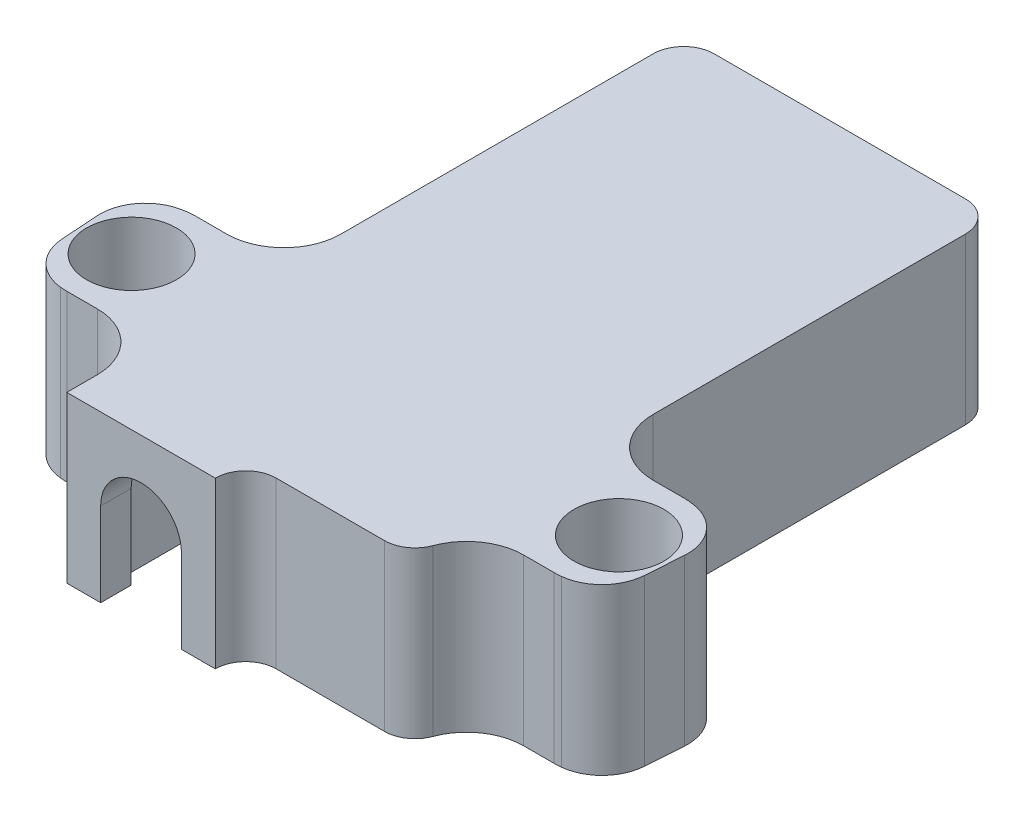
from build123d import *

# Parameters (mm, degrees)
SKETCH1_W           = 20.5
SKETCH1_H           = 38.5
SKETCH1_R           = 4.25
SKETCH1_R_2         = 1.75
BOSS_EXTRUDE1_DEPTH = 1.5
SKETCH2_W           = 20.5
SKETCH2_H           = 38.5
BOSS_EXTRUDE2_DEPTH = 7.35
SKETCH3_W           = 17.5
SKETCH3_H           = 35.5
SKETCH3_W_2         = 6.75
SKETCH3_H_2         = 1.5
CUT_EXTRUDE1_DEPTH  = 7.35
SKETCH4_W           = 7.2
SKETCH4_H           = 1.5
CUT_EXTRUDE2_DEPTH  = 4.05
SKETCH6_W           = 17.5
SKETCH6_H           = 1.5
BOSS_EXTRUDE3_DEPTH = 1.35
SKETCH7_W           = 3.5
SKETCH7_H           = 2
BOSS_EXTRUDE4_DEPTH = 1
SKETCH8_R           = 2.95
BOSS_EXTRUDE5_DEPTH = 7.35
FILLET2_R           = 3.75
CUT_EXTRUDE4_START  = -8.85
CUT_EXTRUDE4_DEPTH  = 8.85
FILLET5_R           = 3
SKETCH10_W          = 9.75
SKETCH10_H          = 2
BOSS_EXTRUDE6_DEPTH = 8.85
CUT_EXTRUDE5_REACH  = 47.729
FILLET4_R           = 2
BOSS_EXTRUDE7_START = 2
SKETCH12_R          = 1.75
BOSS_EXTRUDE7_DEPTH = 2


with BuildPart() as part:
    # Sketch1 → Boss-Extrude1 (new body)
    # profile 1 of 5: a face of its own
    with BuildSketch(Plane(origin=(0, 0, 0), x_dir=(1, 0, 0), z_dir=(0, 1, 0))):
        with Locations((0, 11.25)):
            Rectangle(SKETCH1_W, SKETCH1_H)
    # profile 2 of 5: a face of its own
    with BuildSketch(Plane(origin=(0, 0, 0), x_dir=(1, 0, 0), z_dir=(0, 1, 0))):
        with BuildLine():
            Line((-10.25, -4.25), (-10.25, 4.25))
            Line((-10.25, 4.25), (-16, 4.25))
            ThreePointArc((-16, 4.25), (-12.99479618, 3.00520382), (-11.75, 0))
            ThreePointArc((-11.75, 0), (-12.99479618, -3.00520382), (-16, -4.25))
            Line((-16, -4.25), (-10.25, -4.25))
        make_face()
    # profile 3 of 5: a face of its own
    with BuildSketch(Plane(origin=(0, 0, 0), x_dir=(1, 0, 0), z_dir=(0, 1, 0))):
        with Locations((-16, 0)):
            Circle(SKETCH1_R)
        with Locations(Location((-16, 0, 0), (0, 0, 270))):
            Circle(SKETCH1_R_2, mode=Mode.SUBTRACT)
    # profile 4 of 5: a face of its own
    with BuildSketch(Plane(origin=(0, 0, 0), x_dir=(1, 0, 0), z_dir=(0, 1, 0))):
        with BuildLine():
            Line((16, 4.25), (10.25, 4.25))
            Line((10.25, 4.25), (10.25, -4.25))
            Line((10.25, -4.25), (16, -4.25))
            ThreePointArc((16, -4.25), (11.75, 0), (16, 4.25))
        make_face()
    # profile 5 of 5: a face of its own
    with BuildSketch(Plane(origin=(0, 0, 0), x_dir=(1, 0, 0), z_dir=(0, 1, 0))):
        with Locations((16, 0)):
            Circle(SKETCH1_R)
        with Locations(Location((16, 0, 0), (0, 0, 270))):
            Circle(SKETCH1_R_2, mode=Mode.SUBTRACT)
    extrude(amount=BOSS_EXTRUDE1_DEPTH)

    # Sketch2 → Boss-Extrude2 (add)
    with BuildSketch(Plane(origin=(0, 1.5, 0), x_dir=(1, 0, 0), z_dir=(0, 1, 0))):
        with Locations((0, 11.25)):
            Rectangle(SKETCH2_W, SKETCH2_H)
    extrude(amount=BOSS_EXTRUDE2_DEPTH)

    # Sketch3 → Cut-Extrude1 (cut)
    with BuildSketch(Plane.XZ):
        with Locations((0, -11.25)):
            Rectangle(SKETCH3_W, SKETCH3_H)
        with Locations((-5.375, 7.25)):
            Rectangle(SKETCH3_W_2, SKETCH3_H_2)
    extrude(amount=-CUT_EXTRUDE1_DEPTH, mode=Mode.SUBTRACT)

    # Sketch4 → Cut-Extrude2 (cut)
    with BuildSketch(Plane.XZ):
        with Locations((-2.85, -29.75)):
            Rectangle(SKETCH4_W, SKETCH4_H)
    extrude(amount=-CUT_EXTRUDE2_DEPTH, mode=Mode.SUBTRACT)

    # Sketch6 → Boss-Extrude3 (add)
    with BuildSketch(Plane.XZ.offset(-7.35)):
        with Locations((0, -28.25)):
            Rectangle(SKETCH6_W, SKETCH6_H)
    extrude(amount=BOSS_EXTRUDE3_DEPTH)

    # Sketch7 → Boss-Extrude4 (add)
    with BuildSketch(Plane.XY.offset(-29)):
        with Locations((7, 3.25)):
            Rectangle(SKETCH7_W, SKETCH7_H)
    extrude(amount=BOSS_EXTRUDE4_DEPTH)

    # Sketch8 → Boss-Extrude5 (add)
    # profile 1 of 2: a face of its own
    with BuildSketch(Plane(origin=(0, 1.5, 0), x_dir=(1, 0, 0), z_dir=(0, 1, 0))):
        with BuildLine():
            Line((-10.25, -4.25), (-10.25, 4.25))
            Line((-10.25, 4.25), (-16, 4.25))
            ThreePointArc((-16, 4.25), (-20.25, 0), (-16, -4.25))
            Line((-16, -4.25), (-10.25, -4.25))
        make_face()
        with Locations(Location((-16, 0, 0), (0, 0, 90))):
            Circle(SKETCH8_R, mode=Mode.SUBTRACT)
    # profile 2 of 2: a face of its own
    with BuildSketch(Plane(origin=(0, 1.5, 0), x_dir=(1, 0, 0), z_dir=(0, 1, 0))):
        with BuildLine():
            Line((10.25, 4.25), (10.25, -4.25))
            Line((10.25, -4.25), (16, -4.25))
            ThreePointArc((16, -4.25), (20.25, 0), (16, 4.25))
            Line((16, 4.25), (10.25, 4.25))
        make_face()
        with Locations(Location((16, 0, 0), (0, 0, 90))):
            Circle(SKETCH8_R, mode=Mode.SUBTRACT)
    extrude(amount=BOSS_EXTRUDE5_DEPTH)

    # Fillet2
    fillet2_edges = [part.edges().sort_by_distance(p)[0] for p in [
        (10.25, 4.425, -4.25),
        (10.25, 4.425, 4.25),
        (-10.25, 4.425, 4.25),
        (-10.25, 4.425, -4.25),
    ]]
    fillet(fillet2_edges, radius=FILLET2_R - 0.0001)  # a hair under: the kernel refuses the full size

    # Sketch9 → Cut-Extrude4 (cut)
    with BuildSketch(Plane(origin=(0, 8.85, 0), x_dir=(1, 0, 0), z_dir=(0, 1, 0)).offset(CUT_EXTRUDE4_START)):
        with BuildLine():
            Line((-24.982948352, 53.686308531), (-20.952771504, -3.947905519))
            ThreePointArc((-20.952771504, -3.947905519), (-19.171836931, -8.143524448), (-15.185360396, -10.353264474))
            Line((-15.185360396, -10.353264474), (-1.215537244, -12.816521212))
            ThreePointArc((-1.215537244, -12.816521212), (0, -12.922866941), (1.215537244, -12.816521212))
            Line((1.215537244, -12.816521212), (15.185360396, -10.353264474))
            ThreePointArc((15.185360396, -10.353264474), (19.171836931, -8.143524448), (20.952771504, -3.947905519))
            Line((20.952771504, -3.947905519), (24.982948352, 53.686308531))
            ThreePointArc((24.982948352, 53.686308531), (24.995735789, 53.930307371), (25, 54.174603847))
            Line((25, 54.174603847), (25, 107.825396153))
            ThreePointArc((25, 107.825396153), (24.995735789, 108.069692629), (24.982948352, 108.313691469))
            Line((24.982948352, 108.313691469), (20.952771504, 165.947905519))
            ThreePointArc((20.952771504, 165.947905519), (19.171836931, 170.143524448), (15.185360396, 172.353264474))
            Line((15.185360396, 172.353264474), (1.215537244, 174.816521212))
            ThreePointArc((1.215537244, 174.816521212), (0, 174.922866941), (-1.215537244, 174.816521212))
            Line((-1.215537244, 174.816521212), (-15.185360396, 172.353264474))
            ThreePointArc((-15.185360396, 172.353264474), (-19.171836931, 170.143524448), (-20.952771504, 165.947905519))
            Line((-20.952771504, 165.947905519), (-24.982948352, 108.313691469))
            ThreePointArc((-24.982948352, 108.313691469), (-24.995735789, 108.069692629), (-25, 107.825396153))
            Line((-25, 107.825396153), (-25, 54.174603847))
            ThreePointArc((-25, 54.174603847), (-24.995735789, 53.930307371), (-24.982948352, 53.686308531))
        make_face()
        with BuildLine():
            Line((-18.957643404, 165.808392572), (-22.987820251, 108.174178521))
            ThreePointArc((-22.987820251, 108.174178521), (-22.996954135, 107.999893636), (-23, 107.825396153))
            Line((-23, 107.825396153), (-23, 54.174603847))
            ThreePointArc((-23, 54.174603847), (-22.996954135, 54.000106364), (-22.987820251, 53.825821479))
            Line((-22.987820251, 53.825821479), (-18.957643404, -3.808392572))
            ThreePointArc((-18.957643404, -3.808392572), (-17.68554728, -6.805263235), (-14.838064041, -8.383648968))
            Line((-14.838064041, -8.383648968), (-0.868240888, -10.846905706))
            ThreePointArc((-0.868240888, -10.846905706), (0, -10.922866941), (0.868240888, -10.846905706))
            Line((0.868240888, -10.846905706), (14.838064041, -8.383648968))
            ThreePointArc((14.838064041, -8.383648968), (17.68554728, -6.805263235), (18.957643404, -3.808392572))
            Line((18.957643404, -3.808392572), (22.987820251, 53.825821479))
            ThreePointArc((22.987820251, 53.825821479), (22.996954135, 54.000106364), (23, 54.174603847))
            Line((23, 54.174603847), (23, 107.825396153))
            ThreePointArc((23, 107.825396153), (22.996954135, 107.999893636), (22.987820251, 108.174178521))
            Line((22.987820251, 108.174178521), (18.957643404, 165.808392572))
            ThreePointArc((18.957643404, 165.808392572), (17.68554728, 168.805263235), (14.838064041, 170.383648968))
            Line((14.838064041, 170.383648968), (0.868240888, 172.846905706))
            ThreePointArc((0.868240888, 172.846905706), (0, 172.922866941), (-0.868240888, 172.846905706))
            Line((-0.868240888, 172.846905706), (-14.838064041, 170.383648968))
            ThreePointArc((-14.838064041, 170.383648968), (-17.68554728, 168.805263235), (-18.957643404, 165.808392572))
        make_face(mode=Mode.SUBTRACT)
    extrude(amount=CUT_EXTRUDE4_DEPTH, mode=Mode.SUBTRACT)

    # Fillet5
    fillet5_edges = [part.edges().sort_by_distance(p)[0] for p in [
        (-19.402072162, 4.425, -2.547234776),
        (-19.014456867, 4.425, 2.995922195),
        (19.014456867, 4.425, 2.995922195),
        (19.402072162, 4.425, -2.547234776),
    ]]
    fillet(fillet5_edges, radius=FILLET5_R)

    # Sketch10 → Boss-Extrude6 (add)
    with BuildSketch(Plane(origin=(0, 0, 0), x_dir=(1, 0, 0), z_dir=(0, 1, 0))):
        with Locations((-5.375, -9)):
            Rectangle(SKETCH10_W, SKETCH10_H)
    extrude(amount=BOSS_EXTRUDE6_DEPTH)

    # Sketch11 → Cut-Extrude5 (cut, up to next)
    with BuildSketch(Plane.XY.offset(10), mode=Mode.PRIVATE) as cut_extrude5_sk1:
        with BuildLine():
            ThreePointArc((-2.725, 3.5), (-3.50116703, 5.37383297), (-5.375, 6.15))
            Line((-5.375, 6.15), (-5.375, 0.85))
            ThreePointArc((-5.375, 0.85), (-3.50116703, 1.62616703), (-2.725, 3.5))
        make_face()
    cut_extrude5_tool1 = extrude(cut_extrude5_sk1.sketch, amount=-CUT_EXTRUDE5_REACH, mode=Mode.PRIVATE) & part.part
    # Sketch11 → Cut-Extrude5 (cut, up to next)
    with BuildSketch(Plane.XY.offset(10), mode=Mode.PRIVATE) as cut_extrude5_sk2:
        with BuildLine():
            Line((-5.375, 0.85), (-5.375, 6.15))
            ThreePointArc((-5.375, 6.15), (-7.24883297, 5.37383297), (-8.025, 3.5))
            ThreePointArc((-8.025, 3.5), (-7.24883297, 1.62616703), (-5.375, 0.85))
        make_face()
    cut_extrude5_tool2 = extrude(cut_extrude5_sk2.sketch, amount=-CUT_EXTRUDE5_REACH, mode=Mode.PRIVATE) & part.part
    # Sketch11 → Cut-Extrude5 (cut, up to next)
    with BuildSketch(Plane.XY.offset(10), mode=Mode.PRIVATE) as cut_extrude5_sk3:
        with BuildLine():
            ThreePointArc((-2.725, 3.5), (-3.50116703, 5.37383297), (-5.375, 6.15))
            Line((-5.375, 6.15), (-5.375, 0.85))
            ThreePointArc((-5.375, 0.85), (-3.50116703, 1.62616703), (-2.725, 3.5))
        make_face()
    cut_extrude5_tool3 = extrude(cut_extrude5_sk3.sketch, amount=-CUT_EXTRUDE5_REACH, mode=Mode.PRIVATE) & part.part
    # Sketch11 → Cut-Extrude5 (cut, up to next)
    with BuildSketch(Plane.XY.offset(10), mode=Mode.PRIVATE) as cut_extrude5_sk4:
        with BuildLine():
            Line((-5.375, 0.85), (-5.375, 6.15))
            ThreePointArc((-5.375, 6.15), (-7.24883297, 5.37383297), (-8.025, 3.5))
            ThreePointArc((-8.025, 3.5), (-7.24883297, 1.62616703), (-5.375, 0.85))
        make_face()
    cut_extrude5_tool4 = extrude(cut_extrude5_sk4.sketch, amount=-CUT_EXTRUDE5_REACH, mode=Mode.PRIVATE) & part.part
    # Sketch11 → Cut-Extrude5 (cut, up to next)
    with BuildSketch(Plane.XY.offset(10), mode=Mode.PRIVATE) as cut_extrude5_sk5:
        with BuildLine():
            Line((-5.375, 0), (-5.375, 0.85))
            ThreePointArc((-5.375, 0.85), (-7.24883297, 1.62616703), (-8.025, 3.5))
            Line((-8.025, 3.5), (-8.025, 0))
            Line((-8.025, 0), (-5.375, 0))
        make_face()
    cut_extrude5_tool5 = extrude(cut_extrude5_sk5.sketch, amount=-CUT_EXTRUDE5_REACH, mode=Mode.PRIVATE) & part.part
    # Sketch11 → Cut-Extrude5 (cut, up to next)
    with BuildSketch(Plane.XY.offset(10), mode=Mode.PRIVATE) as cut_extrude5_sk6:
        with BuildLine():
            ThreePointArc((-2.725, 3.5), (-3.50116703, 1.62616703), (-5.375, 0.85))
            Line((-5.375, 0.85), (-5.375, 0))
            Line((-5.375, 0), (-2.725, 0))
            Line((-2.725, 0), (-2.725, 3.5))
        make_face()
    cut_extrude5_tool6 = extrude(cut_extrude5_sk6.sketch, amount=-CUT_EXTRUDE5_REACH, mode=Mode.PRIVATE) & part.part
    add(cut_extrude5_tool1.solids().sort_by_distance((-4.250305, 3.5, 10))[0], mode=Mode.SUBTRACT)
    add(cut_extrude5_tool2.solids().sort_by_distance((-6.499695, 3.5, 10))[0], mode=Mode.SUBTRACT)
    add(cut_extrude5_tool3.solids().sort_by_distance((-4.250305, 3.5, 10))[0], mode=Mode.SUBTRACT)
    add(cut_extrude5_tool4.solids().sort_by_distance((-6.499695, 3.5, 10))[0], mode=Mode.SUBTRACT)
    add(cut_extrude5_tool5.solids().sort_by_distance((-6.993859, 0.832642, 10))[0], mode=Mode.SUBTRACT)
    add(cut_extrude5_tool6.solids().sort_by_distance((-3.756141, 0.832642, 10))[0], mode=Mode.SUBTRACT)

    # Fillet4
    fillet4_edges = [part.edges().sort_by_distance(p)[0] for p in [
        (10.25, 4.425, 8),
        (10.25, 4.425, -30.5),
        (-10.25, 4.425, -30.5),
        (-0.5, 4.425, 8),
    ]]
    fillet(fillet4_edges, radius=FILLET4_R - 0.0001)  # a hair under: the kernel refuses the full size

    # Sketch12 → Boss-Extrude7 (add)
    # profile 1 of 2: a face of its own
    with BuildSketch(Plane.XZ.offset(BOSS_EXTRUDE7_START)):
        with BuildLine():
            Line((8.609035337, 8), (1.5, 8))
            ThreePointArc((1.5, 8), (0.085786438, 8.585786438), (-0.5, 10))
            Line((-0.5, 10), (-2.725, 10))
            Line((-2.725, 10), (-2.725, 8))
            Line((-2.725, 8), (-2, 8))
            Line((-2, 8), (-2, 6.5))
            Line((-2, 6.5), (8.75, 6.5))
            Line((8.75, 6.5), (8.75, -29))
            Line((8.75, -29), (0.75, -29))
            Line((0.75, -29), (0.75, -30.5))
            Line((0.75, -30.5), (8.25, -30.5))
            ThreePointArc((8.25, -30.5), (9.664213562, -29.914213562), (10.25, -28.5))
            Line((10.25, -28.5), (10.25, -8))
            ThreePointArc((10.25, -8), (11.348349571, -5.348349571), (14, -4.25))
            Line((14, -4.25), (16, -4.25))
            ThreePointArc((16, -4.25), (16.516297471, -4.218523073), (17.024947197, -4.124558551))
            ThreePointArc((17.024947197, -4.124558551), (18.727817289, -2.97740881), (19.294147209, -1.003836035))
            Line((19.294147209, -1.003836035), (19.122381821, 1.452523454))
            ThreePointArc((19.122381821, 1.452523454), (18.286895141, 3.328071663), (16.440944878, 4.227063711))
            ThreePointArc((16.440944878, 4.227063711), (16.220770502, 4.244262054), (16, 4.25))
            Line((16, 4.25), (14, 4.25))
            ThreePointArc((14, 4.25), (11.858599097, 4.921542241), (10.484153481, 6.695652174))
            ThreePointArc((10.484153481, 6.695652174), (9.751115818, 7.641844138), (8.609035337, 8))
        make_face()
        with Locations(Location((16, 0, 0), (0, 0, 270))):
            Circle(SKETCH12_R, mode=Mode.SUBTRACT)
    # profile 2 of 2: a face of its own
    with BuildSketch(Plane.XZ.offset(BOSS_EXTRUDE7_START)):
        with BuildLine():
            Line((-10.25, -8), (-10.25, -28.5))
            ThreePointArc((-10.25, -28.5), (-9.664213562, -29.914213562), (-8.25, -30.5))
            Line((-8.25, -30.5), (-6.45, -30.5))
            Line((-6.45, -30.5), (-6.45, -29))
            Line((-6.45, -29), (-8.75, -29))
            Line((-8.75, -29), (-8.75, 8))
            Line((-8.75, 8), (-8.025, 8))
            Line((-8.025, 8), (-8.025, 10))
            Line((-8.025, 10), (-10.25, 10))
            Line((-10.25, 10), (-10.25, 8))
            ThreePointArc((-10.25, 8), (-11.348349571, 5.348349571), (-14, 4.25))
            Line((-14, 4.25), (-16, 4.25))
            ThreePointArc((-16, 4.25), (-16.220770502, 4.244262054), (-16.440944878, 4.227063711))
            ThreePointArc((-16.440944878, 4.227063711), (-18.286895141, 3.328071663), (-19.122381821, 1.452523454))
            Line((-19.122381821, 1.452523454), (-19.294147209, -1.003836035))
            ThreePointArc((-19.294147209, -1.003836035), (-18.727817289, -2.97740881), (-17.024947197, -4.124558551))
            ThreePointArc((-17.024947197, -4.124558551), (-16.516297471, -4.218523073), (-16, -4.25))
            Line((-16, -4.25), (-14, -4.25))
            ThreePointArc((-14, -4.25), (-11.348349571, -5.348349571), (-10.25, -8))
        make_face()
        with Locations(Location((-16, 0, 0), (0, 0, 270))):
            Circle(SKETCH12_R, mode=Mode.SUBTRACT)
    extrude(amount=-BOSS_EXTRUDE7_DEPTH)


solid = part.part
